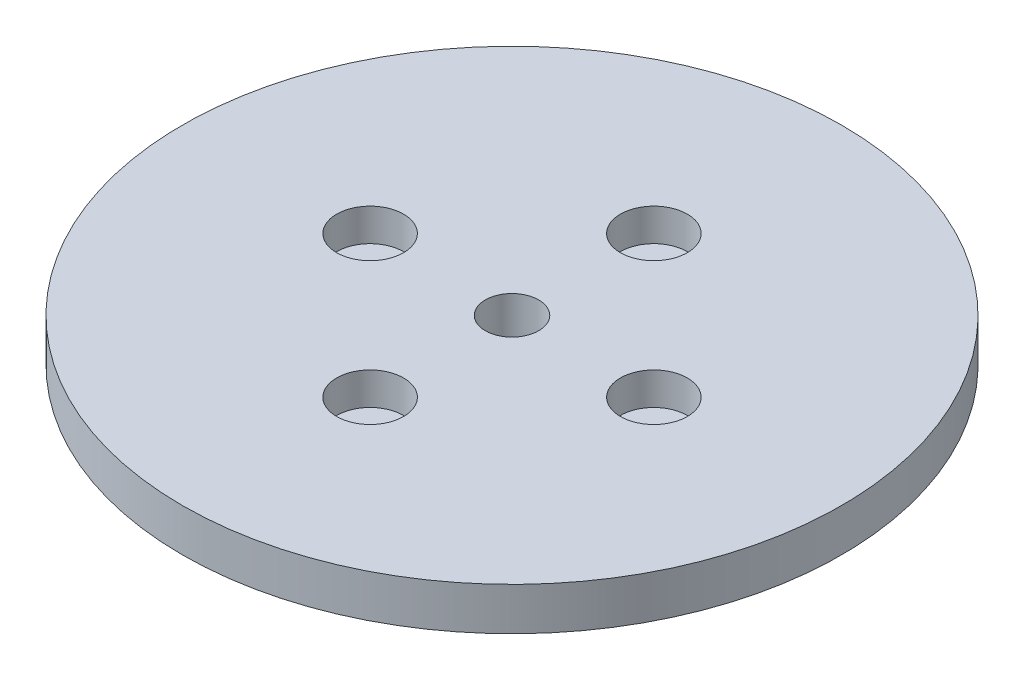
from build123d import *

# Parameters (mm, degrees)
SKETCH1_R           = 92.5
BOSS_EXTRUDE1_DEPTH = 12
SKETCH2_R           = 7.5
CUT_EXTRUDE1_DEPTH  = 132.363998112
SKETCH3_R           = 9.388365159
CUT_EXTRUDE2_DEPTH  = 9.127200818
CIRPATTERN1_COUNT   = 4


with BuildPart() as part:
    # Sketch1 → Boss-Extrude1 (new body)
    with BuildSketch(Plane(origin=(0, 0, 0), x_dir=(1, 0, 0), z_dir=(0, 1, 0))):
        Circle(SKETCH1_R)
    extrude(amount=BOSS_EXTRUDE1_DEPTH)

    # Sketch2 → Cut-Extrude1 (cut, through all)
    with BuildSketch(Plane(origin=(0, 0, 0), x_dir=(1, 0, 0), z_dir=(0, 1, 0))):
        Circle(SKETCH2_R)
    extrude(amount=CUT_EXTRUDE1_DEPTH, mode=Mode.SUBTRACT)

    # Sketch3 → Cut-Extrude2 (cut)
    with BuildSketch(Plane(origin=(0, 12, 0), x_dir=(1, 0, 0), z_dir=(0, 1, 0))):
        with Locations((-39.819354828, 0)):
            Circle(SKETCH3_R)
    cut_extrude2 = extrude(amount=-CUT_EXTRUDE2_DEPTH, mode=Mode.SUBTRACT)

    # CirPattern1: Cut-Extrude2 ×4 about axis
    cirpattern1_axis = Axis((0, 0, 0), (0, 1, 0))
    for i in range(1, CIRPATTERN1_COUNT):
        add(cut_extrude2.rotate(cirpattern1_axis, i * 360 / CIRPATTERN1_COUNT), mode=Mode.SUBTRACT)


solid = part.part
